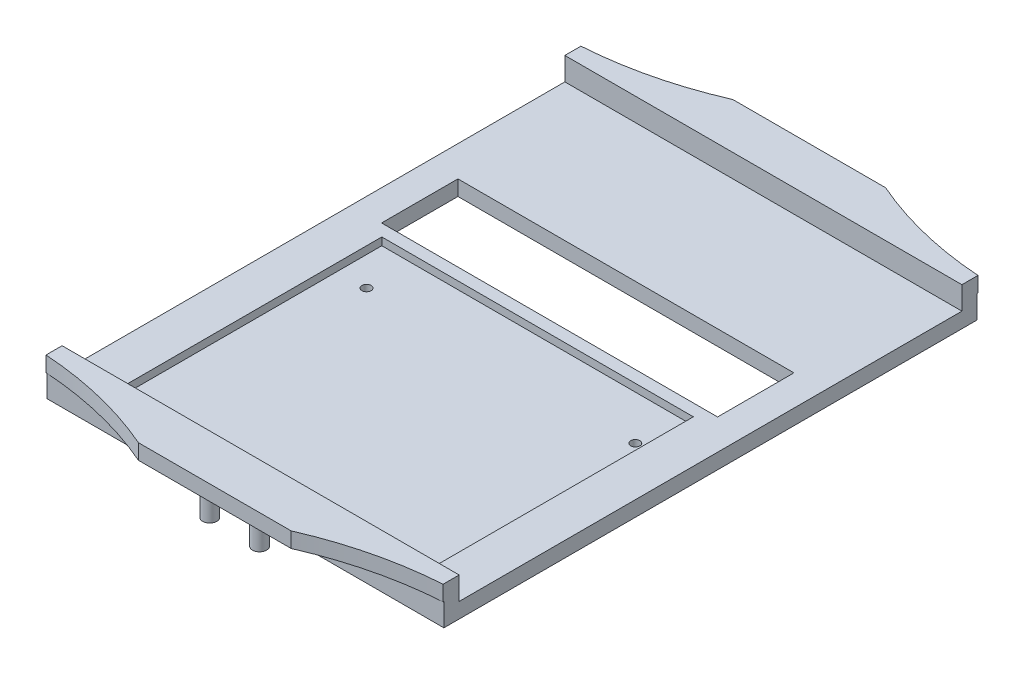
from build123d import *

# Parameters (mm, degrees)
BOSS_EXTRUDE1_DEPTH     = 150
CUT_EXTRUDE2_REACH      = 244.83
SKETCH2_W               = 50
SKETCH2_H               = 10
FILLET1_R               = 120
SKETCH4_R               = 2.3
BOSS_EXTRUDE2_DEPTH     = 16
SKETCH7_R               = 2.15
CUT_EXTRUDE4_DEPTH      = 11
SKETCH8_W               = 110
SKETCH8_H               = 25
CUT_EXTRUDE5_DEPTH      = 5
CUT_EXTRUDE6_DEPTH      = 2.5
SKETCH10_3_R            = 1.5
CUT_EXTRUDE7_DEPTH      = 239.011365275
FILLET2_R               = 1
CUT_EXTRUDE8_DEPTH      = 239.011365275
CUT_EXTRUDE8_DEPTH_BACK = 239.011365275
SKETCH11_W              = 10
SKETCH11_H              = 194.6


with BuildPart() as part:
    # Sketch1 → Boss-Extrude1 (new body)
    with BuildSketch(Plane(origin=(0, 0, 0), x_dir=(0, 0, -1), z_dir=(1, 0, 0))):
        Polygon((-174.6, 36.381974353), (-174.6, 43.881974353), (-184.6, 43.881974353), (-184.6, 48.881974353), (-169.6, 48.881974353), (-169.6, 41.381974353), (-5, 41.381974353), (-5, 48.881974353), (10, 48.881974353), (10, 43.881974353), (0, 43.881974353), (0, 36.381974353), align=None)
    extrude(amount=BOSS_EXTRUDE1_DEPTH)

    # Sketch2 → Cut-Extrude2 (cut, up to next)
    with BuildSketch(Plane(origin=(0, 0, 0), x_dir=(1, 0, 0), z_dir=(0, 1, 0)), mode=Mode.PRIVATE) as cut_extrude2_sk1:
        with Locations((25, 5)):
            Rectangle(SKETCH2_W, SKETCH2_H)
    cut_extrude2_tool1 = extrude(cut_extrude2_sk1.sketch, amount=CUT_EXTRUDE2_REACH, mode=Mode.PRIVATE) & part.part
    # Sketch2 → Cut-Extrude2 (cut, up to next)
    with BuildSketch(Plane(origin=(0, 0, 0), x_dir=(1, 0, 0), z_dir=(0, 1, 0)), mode=Mode.PRIVATE) as cut_extrude2_sk2:
        with Locations((125, 5)):
            Rectangle(SKETCH2_W, SKETCH2_H)
    cut_extrude2_tool2 = extrude(cut_extrude2_sk2.sketch, amount=CUT_EXTRUDE2_REACH, mode=Mode.PRIVATE) & part.part
    # Sketch2 → Cut-Extrude2 (cut, up to next)
    with BuildSketch(Plane(origin=(0, 0, 0), x_dir=(1, 0, 0), z_dir=(0, 1, 0)), mode=Mode.PRIVATE) as cut_extrude2_sk3:
        with Locations((25, -179.6)):
            Rectangle(SKETCH2_W, SKETCH2_H)
    cut_extrude2_tool3 = extrude(cut_extrude2_sk3.sketch, amount=CUT_EXTRUDE2_REACH, mode=Mode.PRIVATE) & part.part
    # Sketch2 → Cut-Extrude2 (cut, up to next)
    with BuildSketch(Plane(origin=(0, 0, 0), x_dir=(1, 0, 0), z_dir=(0, 1, 0)), mode=Mode.PRIVATE) as cut_extrude2_sk4:
        with Locations((125, -179.6)):
            Rectangle(SKETCH2_W, SKETCH2_H)
    cut_extrude2_tool4 = extrude(cut_extrude2_sk4.sketch, amount=CUT_EXTRUDE2_REACH, mode=Mode.PRIVATE) & part.part
    add(cut_extrude2_tool1.solids().sort_by_distance((25, 0, -5))[0], mode=Mode.SUBTRACT)
    add(cut_extrude2_tool2.solids().sort_by_distance((125, 0, -5))[0], mode=Mode.SUBTRACT)
    add(cut_extrude2_tool3.solids().sort_by_distance((25, 0, 179.6))[0], mode=Mode.SUBTRACT)
    add(cut_extrude2_tool4.solids().sort_by_distance((125, 0, 179.6))[0], mode=Mode.SUBTRACT)

    # Fillet1
    # the kernel refuses this fillet: 120 mm, written as the material it adds along each edge
    with BuildSketch(Plane(origin=(50, 43.881974353, 174.6), x_dir=(-1, 0, 0), z_dir=(0, 1, 0)), Plane(origin=(100, 43.881974353, 0), x_dir=(1, 0, 0), z_dir=(0, 1, 0))) as fillet1_piece_1:
        with BuildLine():
            CenterArc((47.958315233, 120), FILLET1_R, 246.443535691, 23.556464309)
            Line((0, 10), (0, 0))
            Line((0, 0), (47.958315233, 0))
        make_face()
    extrude(amount=5)
    with BuildSketch(Plane(origin=(100, 43.881974353, 174.6), x_dir=(1, 0, 0), z_dir=(0, 1, 0)), Plane(origin=(50, 43.881974353, 0), x_dir=(-1, 0, 0), z_dir=(0, 1, 0))) as fillet1_piece_2:
        with BuildLine():
            CenterArc((47.958315233, -120), FILLET1_R, 90, 23.556464309)
            Line((0, -10), (0, 0))
            Line((0, 0), (47.958315233, 0))
        make_face()
    extrude(amount=5)

    # Sketch4 → Boss-Extrude2 (add)
    with BuildSketch(Plane(origin=(0, 48.881974353, 0), x_dir=(1, 0, 0), z_dir=(0, 1, 0))):
        with Locations(Location((66.85, -178.1, 0), (0, 0, 270))):
            Circle(SKETCH4_R)
        with Locations(Location((83.15, -178.1, 0), (0, 0, 270))):
            Circle(SKETCH4_R)
        with Locations(Location((83.15, 3.5, 0), (0, 0, 270))):
            Circle(SKETCH4_R)
        with Locations(Location((66.85, 3.5, 0), (0, 0, 270))):
            Circle(SKETCH4_R)
    extrude(amount=-BOSS_EXTRUDE2_DEPTH)

    # Sketch7 → Cut-Extrude4 (cut)
    with BuildSketch(Plane.XZ.offset(-32.881974353)):
        with Locations(Location((66.85, 178.1, 0), (0, 0, 270))):
            Circle(SKETCH7_R)
        with Locations(Location((83.15, 178.1, 0), (0, 0, 270))):
            Circle(SKETCH7_R)
        with Locations(Location((66.85, -3.5, 0), (0, 0, 270))):
            Circle(SKETCH7_R)
        with Locations(Location((83.15, -3.5, 0), (0, 0, 270))):
            Circle(SKETCH7_R)
    extrude(amount=-CUT_EXTRUDE4_DEPTH, mode=Mode.SUBTRACT)

    # Sketch8 → Cut-Extrude5 (cut)
    with BuildSketch(Plane(origin=(0, 41.381974353, 0), x_dir=(1, 0, 0), z_dir=(0, 1, 0))):
        with Locations((75, -62.5)):
            Rectangle(SKETCH8_W, SKETCH8_H)
    extrude(amount=-CUT_EXTRUDE5_DEPTH, mode=Mode.SUBTRACT)

    # Sketch10 → Cut-Extrude6 (cut)
    with BuildSketch(Plane(origin=(0, 41.381974353, 0), x_dir=(1, 0, 0), z_dir=(0, 1, 0))):
        Polygon((25, -78.925), (126, -78.925), (126, -165.67443804), (24, -165.67443804), (24, -78.925), align=None)
    extrude(amount=-CUT_EXTRUDE6_DEPTH, mode=Mode.SUBTRACT)

    # Sketch10<3> → Cut-Extrude7 (cut, through all)
    with BuildSketch(Plane(origin=(0, 41.381974353, 0), x_dir=(1, 0, 0), z_dir=(0, 1, 0))):
        with Locations(Location((33.5, -93.425, 0), (0, 0, 270))):
            Circle(SKETCH10_3_R)
        with Locations(Location((121.5, -93.425, 0), (0, 0, 270))):
            Circle(SKETCH10_3_R)
        with Locations(Location((121.5, -161.17443804, 0), (0, 0, 270))):
            Circle(SKETCH10_3_R)
        with Locations(Location((33.5, -161.17443804, 0), (0, 0, 270))):
            Circle(SKETCH10_3_R)
    extrude(amount=-CUT_EXTRUDE7_DEPTH, mode=Mode.SUBTRACT)

    # Fillet2
    fillet2_edges = [part.edges().sort_by_distance(p)[0] for p in [
        (66.85, 43.881974353, 175.8),
        (83.15, 43.881974353, 175.8),
        (83.15, 43.881974353, -5.8),
        (66.85, 43.881974353, -5.8),
    ]]
    fillet(fillet2_edges, radius=FILLET2_R)

    # Sketch11 → Cut-Extrude8 (cut, two sides: drawn at the far end of the back side and taken through both)
    with BuildSketch(Plane(origin=(0, 41.381974353, 0), x_dir=(1, 0, 0), z_dir=(0, 1, 0)).offset(-CUT_EXTRUDE8_DEPTH_BACK)):
        with Locations((5, -87.3)):
            Rectangle(SKETCH11_W, SKETCH11_H)
        with Locations((145, -87.3)):
            Rectangle(SKETCH11_W, SKETCH11_H)
    extrude(amount=CUT_EXTRUDE8_DEPTH + CUT_EXTRUDE8_DEPTH_BACK, mode=Mode.SUBTRACT)


solid = part.part
